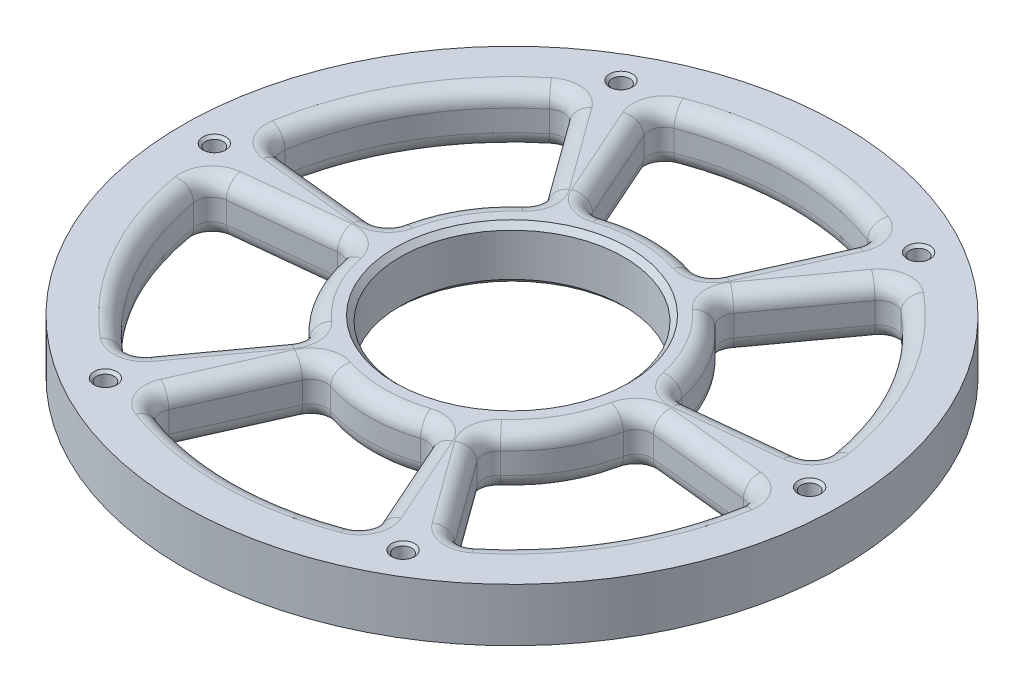
from build123d import *

# Parameters (mm, degrees)
SKETCH1_R                    = 62
SKETCH1_R_2                  = 21.025
BOSS_EXTRUDE1_DEPTH          = 10
SKETCH3_R                    = 1.65
CUT_EXTRUDE1_DEPTH           = 89.249645892
CHAMFER1_SIZE                = 0.5
CIRPATTERN1_COUNT            = 6
CHAMFER1_OF_CIRPATTERN1_SIZE = 0.5
CUT_EXTRUDE3_DEPTH           = 89.249645892
FILLET1_R                    = 3
CIRPATTERN2_COUNT            = 6
FILLET1_OF_CIRPATTERN2_R     = 3
CHAMFER2_SIZE                = 1


with BuildPart() as part:
    # Sketch1 → Boss-Extrude1 (new body)
    with BuildSketch(Plane(origin=(0, 0, 0), x_dir=(1, 0, 0), z_dir=(0, 1, 0))):
        Circle(SKETCH1_R)
        Circle(SKETCH1_R_2, mode=Mode.SUBTRACT)
    extrude(amount=BOSS_EXTRUDE1_DEPTH)

    # Sketch3 → Cut-Extrude1 (cut, through all)
    with BuildSketch(Plane(origin=(0, 10, 0), x_dir=(1, 0, 0), z_dir=(0, 1, 0))):
        with Locations((-56, 0)):
            Circle(SKETCH3_R)
    cut_extrude1 = extrude(amount=-CUT_EXTRUDE1_DEPTH, mode=Mode.SUBTRACT)

    # Chamfer1
    chamfer1_edges = [part.edges().sort_by_distance(p)[0] for p in [
        (-57.65, 10, 0),
    ]]
    chamfer(chamfer1_edges, length=CHAMFER1_SIZE)

    # CirPattern1: Cut-Extrude1 ×6 about axis
    cirpattern1_axis = Axis((0, 10, 0), (0, 1, 0))
    for i in range(1, CIRPATTERN1_COUNT):
        add(cut_extrude1.rotate(cirpattern1_axis, i * 360 / CIRPATTERN1_COUNT), mode=Mode.SUBTRACT)

    # Chamfer1 of CirPattern1
    chamfer1_of_cirpattern1_edges = [part.edges().sort_by_distance(p)[0] for p in [
        (-28.825, 10, 49.926364528),
        (28.825, 10, 49.926364528),
        (57.65, 10, 0),
        (28.825, 10, -49.926364528),
        (-28.825, 10, -49.926364528),
    ]]
    chamfer(chamfer1_of_cirpattern1_edges, length=CHAMFER1_OF_CIRPATTERN1_SIZE)

    # Sketch5 → Cut-Extrude3 (cut, through all)
    with BuildSketch(Plane(origin=(0, 10, 0), x_dir=(1, 0, 0), z_dir=(0, 1, 0))):
        with BuildLine():
            Line((-21.15030544, 47.504363797), (-10.992057779, 24.688565993))
            ThreePointArc((-10.992057779, 24.688565993), (0, 27.025), (10.992057779, 24.688565993))
            Line((10.992057779, 24.688565993), (21.15030544, 47.504363797))
            ThreePointArc((21.15030544, 47.504363797), (0, 52), (-21.15030544, 47.504363797))
        make_face()
    cut_extrude3 = extrude(amount=-CUT_EXTRUDE3_DEPTH, mode=Mode.SUBTRACT)

    # Fillet1
    fillet1_edges = [part.edges().sort_by_distance(p)[0] for p in [
        (0, 10, -52),
        (-21.15030544, 5, -47.504363797),
        (21.15030544, 5, -47.504363797),
        (10.992057779, 5, -24.688565993),
        (-10.992057779, 5, -24.688565993),
        (16.07118161, 0, -36.096464895),
        (0, 0, -27.025),
        (-16.07118161, 0, -36.096464895),
        (0, 0, -52),
        (0, 10, -27.025),
        (16.07118161, 10, -36.096464895),
        (-16.07118161, 10, -36.096464895),
    ]]
    fillet(fillet1_edges, radius=FILLET1_R)

    # CirPattern2: Cut-Extrude3 ×6 about axis
    cirpattern2_axis = Axis((0, 10, 0), (0, 1, 0))
    for i in range(1, CIRPATTERN2_COUNT):
        add(cut_extrude3.rotate(cirpattern2_axis, i * 360 / CIRPATTERN2_COUNT), mode=Mode.SUBTRACT)

    # Fillet1 of CirPattern2
    fillet1_of_cirpattern2_edges = [part.edges().sort_by_distance(p)[0] for p in [
        (-45.033320997, 10, -26),
        (-51.715138559, 5, -5.43548009),
        (-30.564833119, 5, -42.068883707),
        (-15.884896443, 5, -21.863684273),
        (-26.876954222, 5, -2.82488172),
        (-23.224864781, 0, -31.96628399),
        (-23.404336537, 0, -13.5125),
        (-39.296046391, 0, -4.130180905),
        (-45.033320997, 0, -26),
        (-23.404336537, 10, -13.5125),
        (-23.224864781, 10, -31.96628399),
        (-39.296046391, 10, -4.130180905),
        (-45.033320997, 10, 26),
        (-30.564833119, 5, 42.068883707),
        (-51.715138559, 5, 5.43548009),
        (-26.876954222, 5, 2.82488172),
        (-15.884896443, 5, 21.863684273),
        (-39.296046391, 0, 4.130180905),
        (-23.404336537, 0, 13.5125),
        (-23.224864781, 0, 31.96628399),
        (-45.033320997, 0, 26),
        (-23.404336537, 10, 13.5125),
        (-39.296046391, 10, 4.130180905),
        (-23.224864781, 10, 31.96628399),
        (0, 10, 52),
        (21.15030544, 5, 47.504363797),
        (-21.15030544, 5, 47.504363797),
        (-10.992057779, 5, 24.688565993),
        (10.992057779, 5, 24.688565993),
        (-16.07118161, 0, 36.096464895),
        (0, 0, 27.025),
        (16.07118161, 0, 36.096464895),
        (0, 0, 52),
        (0, 10, 27.025),
        (-16.07118161, 10, 36.096464895),
        (16.07118161, 10, 36.096464895),
        (45.033320997, 10, 26),
        (51.715138559, 5, 5.43548009),
        (30.564833119, 5, 42.068883707),
        (15.884896443, 5, 21.863684273),
        (26.876954222, 5, 2.82488172),
        (23.224864781, 0, 31.96628399),
        (23.404336537, 0, 13.5125),
        (39.296046391, 0, 4.130180905),
        (45.033320997, 0, 26),
        (23.404336537, 10, 13.5125),
        (23.224864781, 10, 31.96628399),
        (39.296046391, 10, 4.130180905),
        (45.033320997, 10, -26),
        (30.564833119, 5, -42.068883707),
        (51.715138559, 5, -5.43548009),
        (26.876954222, 5, -2.82488172),
        (15.884896443, 5, -21.863684273),
        (39.296046391, 0, -4.130180905),
        (23.404336537, 0, -13.5125),
        (23.224864781, 0, -31.96628399),
        (45.033320997, 0, -26),
        (23.404336537, 10, -13.5125),
        (39.296046391, 10, -4.130180905),
        (23.224864781, 10, -31.96628399),
    ]]
    fillet(fillet1_of_cirpattern2_edges, radius=FILLET1_OF_CIRPATTERN2_R)

    # Chamfer2
    chamfer2_edges = [part.edges().sort_by_distance(p)[0] for p in [
        (-21.025, 10, 0),
        (-21.025, 0, 0),
    ]]
    chamfer(chamfer2_edges, length=CHAMFER2_SIZE)


solid = part.part
